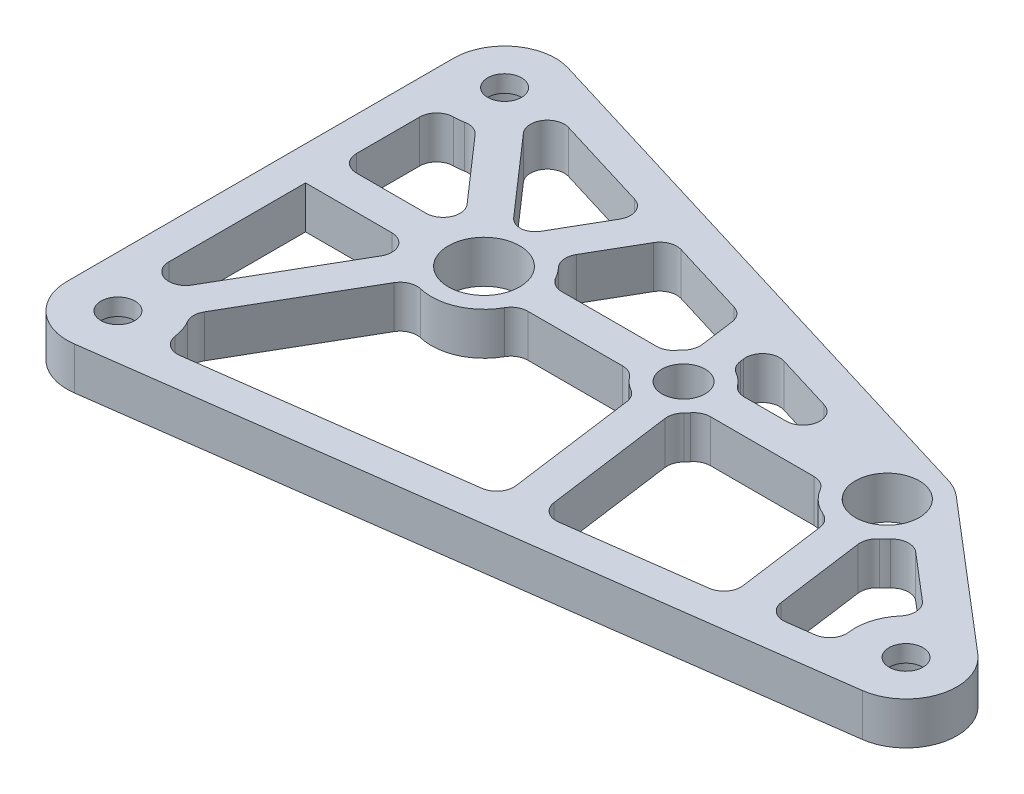
from build123d import *

# Parameters (mm, degrees)
SKETCH1_W           = 68.667901423
SKETCH1_H           = 36.53900895
SKETCH1_R           = 1.6129
SKETCH1_R_2         = 2.667
BOSS_EXTRUDE1_DEPTH = 3.175
SKETCH2_R           = 1.27
CUT_EXTRUDE1_DEPTH  = 38.354
CUT_EXTRUDE2_START  = -1.905
SKETCH3_R           = 2.54
SKETCH3_R_2         = 1.27
CUT_EXTRUDE2_DEPTH  = 1.905
SKETCH4_R           = 1.016
CUT_EXTRUDE3_DEPTH  = 25.4
SKETCH5_R           = 2.3876
CUT_EXTRUDE4_DEPTH  = 19.05
CUT_EXTRUDE5_DEPTH  = 19.05
FILLET1_R           = 1.27
FILLET2_R           = 1.27
FILLET3_R           = 1.27
FILLET4_START       = -1
FILLET4_DEPTH       = 5
FILLET4_2_DEPTH     = 3.175
FILLET5_R           = 1.27
FILLET6_R           = 1.27
FILLET7_START       = -1
FILLET7_DEPTH       = 5
FILLET7_2_DEPTH     = 3.175
FILLET8_R           = 1.27


with BuildPart() as part:
    # Sketch1 → Boss-Extrude1 (new body)
    with BuildSketch(Plane(origin=(0, 0, 0), x_dir=(1, 0, 0), z_dir=(0, 1, 0))):
        with Locations((4.791902673, -2.112780122)):
            Rectangle(SKETCH1_W, SKETCH1_H)
        with Locations(Location((0, 0, 0), (0, 0, 270))):
            Circle(SKETCH1_R, mode=Mode.SUBTRACT)
        with Locations(Location((-14.9225, 0, 0), (0, 0, 270))):
            Circle(SKETCH1_R_2, mode=Mode.SUBTRACT)
    extrude(amount=BOSS_EXTRUDE1_DEPTH)

    # Sketch2 → Cut-Extrude1 (cut)
    with BuildSketch(Plane(origin=(0, 3.175, 0), x_dir=(1, 0, 0), z_dir=(0, 1, 0))):
        with Locations(Location((-25.732048039, 12.346724353, 0), (0, 0, 270))):
            Circle(SKETCH2_R)
        with Locations(Location((-25.732048039, -16.572284597, 0), (0, 0, 270))):
            Circle(SKETCH2_R)
        with Locations(Location((26.190646926, -9.550213888, 0), (0, 0, 270))):
            Circle(SKETCH2_R)
    extrude(amount=-CUT_EXTRUDE1_DEPTH, mode=Mode.SUBTRACT)

    # Sketch3 → Cut-Extrude2 (cut)
    # profile 1 of 3: a face of its own
    with BuildSketch(Plane.XZ.offset(CUT_EXTRUDE2_START)):
        with Locations(Location((26.190646926, 9.550213888, 0), (0, 0, 270))):
            Circle(SKETCH3_R)
        with Locations(Location((26.190646926, 9.550213888, 0), (0, 0, 90))):
            Circle(SKETCH3_R_2, mode=Mode.SUBTRACT)
    # profile 2 of 3: a face of its own
    with BuildSketch(Plane.XZ.offset(CUT_EXTRUDE2_START)):
        with Locations(Location((-25.732048039, -12.346724353, 0), (0, 0, 270))):
            Circle(SKETCH3_R)
        with Locations(Location((-25.732048039, -12.346724353, 0), (0, 0, 90))):
            Circle(SKETCH3_R_2, mode=Mode.SUBTRACT)
    # profile 3 of 3: a face of its own
    with BuildSketch(Plane.XZ.offset(CUT_EXTRUDE2_START)):
        with Locations(Location((-25.732048039, 16.572284597, 0), (0, 0, 270))):
            Circle(SKETCH3_R)
        with Locations(Location((-25.732048039, 16.572284597, 0), (0, 0, 90))):
            Circle(SKETCH3_R_2, mode=Mode.SUBTRACT)
    extrude(amount=CUT_EXTRUDE2_DEPTH, mode=Mode.SUBTRACT)

    # Sketch4 → Cut-Extrude3 (cut)
    with BuildSketch(Plane(origin=(0, 3.175, 0), x_dir=(1, 0, 0), z_dir=(0, 1, 0))):
        with Locations(Location((15.24, 0, 0), (0, 0, 270))):
            Circle(SKETCH4_R)
    extrude(amount=-CUT_EXTRUDE3_DEPTH, mode=Mode.SUBTRACT)

    # Sketch5 → Cut-Extrude4 (cut)
    with BuildSketch(Plane(origin=(0, 3.175, 0), x_dir=(1, 0, 0), z_dir=(0, 1, 0))):
        with Locations(Location((15.24, 0, 0), (0, 0, 270))):
            Circle(SKETCH5_R)
    extrude(amount=-CUT_EXTRUDE4_DEPTH, mode=Mode.SUBTRACT)

    # Sketch7 → Cut-Extrude5 (cut)
    with BuildSketch(Plane.XZ):
        with BuildLine():
            ThreePointArc((24.283482048, 6.25190794), (22.535559112, 8.474838107), (22.801156981, 11.290173058))
            Line((22.801156981, 11.290173058), (18.133820494, 11.921387729))
            Line((18.133820494, 11.921387729), (16.958238715, 3.228884247))
            ThreePointArc((16.958238715, 3.228884247), (17.943553782, 2.463500498), (18.614285435, 1.411465749))
            Line((18.614285435, 1.411465749), (24.283482048, 6.25190794))
        make_face()
        with BuildLine():
            Line((3.167554903, 13.945438586), (1.605400683, 2.394535666))
            ThreePointArc((1.605400683, 2.394535666), (2.170826382, 1.897004278), (2.588090495, 1.27))
            Line((2.588090495, 1.27), (11.809965341, 1.27))
            ThreePointArc((11.809965341, 1.27), (12.833228053, 2.754176203), (14.441153278, 3.569297084))
            Line((14.441153278, 3.569297084), (15.616735056, 12.261800567))
            Line((15.616735056, 12.261800567), (3.167554903, 13.945438586))
        make_face()
        with BuildLine():
            Line((0.911684755, -2.734948504), (0.515711761, -5.662857637))
            Line((0.515711761, -5.662857637), (12.235310683, -2.085636563))
            ThreePointArc((12.235310683, -2.085636563), (11.996894404, -1.691243285), (11.809965341, -1.27))
            Line((11.809965341, -1.27), (2.588090495, -1.27))
            ThreePointArc((2.588090495, -1.27), (1.897004278, -2.170826382), (0.911684755, -2.734948504))
        make_face()
        with BuildLine():
            Line((-22.833883449, 14.099079792), (-16.706992842, 3.509352404))
            ThreePointArc((-16.706992842, 3.509352404), (-13.440421223, 3.647384199), (-11.195964209, 1.27))
            Line((-11.195964209, 1.27), (-2.588090495, 1.27))
            ThreePointArc((-2.588090495, 1.27), (-1.897004278, 2.170826382), (-0.911684755, 2.734948504))
            Line((-0.911684755, 2.734948504), (0.650469465, 14.285851424))
            Line((0.650469465, 14.285851424), (-22.002145257, 17.349410864))
            ThreePointArc((-22.002145257, 17.349410864), (-21.942125243, 16.962906152), (-21.922048039, 16.572284597))
            ThreePointArc((-21.922048039, 16.572284597), (-22.15726783, 15.254314015), (-22.833883449, 14.099079792))
        make_face()
        with BuildLine():
            ThreePointArc((-11.195964209, -1.27), (-11.813082161, -2.41484776), (-12.76953075, -3.296163286))
            Line((-12.76953075, -3.296163286), (-9.611736397, -8.754100026))
            Line((-9.611736397, -8.754100026), (-2.1577732, -6.478896377))
            Line((-2.1577732, -6.478896377), (-1.605400683, -2.394535666))
            ThreePointArc((-1.605400683, -2.394535666), (-2.170826382, -1.897004278), (-2.588090495, -1.27))
            Line((-2.588090495, -1.27), (-11.195964209, -1.27))
        make_face()
        with BuildLine():
            ThreePointArc((-15.346499164, -3.914101903), (-15.893789027, -3.815306885), (-16.421697772, -3.640381167))
            Line((-16.421697772, -3.640381167), (-22.410331951, -10.480631582))
            ThreePointArc((-22.410331951, -10.480631582), (-22.046139854, -11.382265514), (-21.922048039, -12.346724353))
            ThreePointArc((-21.922048039, -12.346724353), (-21.922952719, -12.429747482), (-21.925666328, -12.512731183))
            Line((-21.925666328, -12.512731183), (-12.105779444, -9.515366978))
            Line((-12.105779444, -9.515366978), (-15.346499164, -3.914101903))
        make_face()
        with BuildLine():
            Line((-24.32140384, -8.807489557), (-18.332769661, -1.967239142))
            ThreePointArc((-18.332769661, -1.967239142), (-18.507891697, -1.62632573), (-18.649035791, -1.27))
            Line((-18.649035791, -1.27), (-27.002048039, -1.27))
            Line((-27.002048039, -1.27), (-27.002048039, -8.754621904))
            ThreePointArc((-27.002048039, -8.754621904), (-25.656921846, -8.5374651), (-24.32140384, -8.807489557))
        make_face()
        with BuildLine():
            Line((-27.002048039, 1.27), (-18.649035791, 1.27))
            ThreePointArc((-18.649035791, 1.27), (-18.591418386, 1.42793798), (-18.527110715, 1.583272117))
            Line((-18.527110715, 1.583272117), (-25.032426592, 12.82707034))
            ThreePointArc((-25.032426592, 12.82707034), (-26.027333883, 12.773744578), (-27.002048039, 12.980182148))
            Line((-27.002048039, 12.980182148), (-27.002048039, 1.27))
        make_face()
        with BuildLine():
            Line((16.307789916, -3.498265635), (-24.619766876, -15.990751056))
            ThreePointArc((-24.619766876, -15.990751056), (-25.16974996, -16.11500259), (-25.732048039, -16.156724353))
            Line((-25.732048039, -16.156724353), (39.125853384, -16.156724353))
            Line((39.125853384, -16.156724353), (39.125853384, 20.382284597))
            Line((39.125853384, 20.382284597), (-25.732048066, 20.382284597))
            ThreePointArc((-25.732048066, 20.382284597), (-25.476160651, 20.373681924), (-25.221428783, 20.347912753))
            Line((-25.221428783, 20.347912753), (26.701266182, 13.325842044))
            ThreePointArc((26.701266182, 13.325842044), (29.059580471, 12.057267999), (30.000646926, 9.550213888))
            ThreePointArc((30.000646926, 9.550213888), (29.650549633, 7.954853972), (28.66459797, 6.652686281))
            Line((28.66459797, 6.652686281), (17.614993002, -2.781626503))
            ThreePointArc((17.614993002, -2.781626503), (16.998289358, -3.207250582), (16.307789916, -3.498265635))
        make_face()
        with BuildLine():
            ThreePointArc((-25.732048039, -16.156724353), (-28.426124875, -15.040801189), (-29.542048039, -12.346724353))
            Line((-29.542048039, -12.346724353), (-29.542048039, -16.156724353))
            Line((-29.542048039, -16.156724353), (-25.732048039, -16.156724353))
        make_face()
        with BuildLine():
            Line((-29.542048039, 20.382284597), (-29.542048039, 16.572284597))
            ThreePointArc((-29.542048039, 16.572284597), (-28.426124885, 19.266361423), (-25.732048066, 20.382284597))
            Line((-25.732048066, 20.382284597), (-29.542048039, 20.382284597))
        make_face()
    extrude(amount=-CUT_EXTRUDE5_DEPTH, mode=Mode.SUBTRACT)

    # Fillet1
    fillet1_edges = [part.edges().sort_by_distance(p)[0] for p in [
        (-0.911684755, 1.5875, 2.734948504),
        (-2.588090495, 1.5875, 1.27),
        (-11.195964209, 1.5875, 1.27),
        (-16.706992842, 1.5875, 3.509352404),
        (-22.833883449, 1.5875, 14.099079792),
        (-22.002145257, 1.5875, 17.349410864),
        (0.650469465, 1.5875, 14.285851424),
        (2.588090495, 1.5875, 1.27),
        (1.605400683, 1.5875, 2.394535666),
        (3.167554903, 1.5875, 13.945438586),
        (15.616735056, 1.5875, 12.261800567),
        (14.441153278, 1.5875, 3.569297084),
        (11.809965341, 1.5875, 1.27),
    ]]
    fillet(fillet1_edges, radius=FILLET1_R)

    # Fillet2
    # the kernel refuses this fillet: 1.27 mm, written as the material it adds along each edge
    with BuildSketch(Plane(origin=(-2.588090495, 0, -1.27), x_dir=(-1, 0, 0), z_dir=(0, 1, 0)), Plane(origin=(0.911684755, 0, -2.734948504), x_dir=(-0.13402080215822088, 0, -0.9909785187323018), z_dir=(0, 1, 0))) as fillet2_piece_1:
        with BuildLine():
            CenterArc((0.697480751, -1.27), FILLET2_R, 90, 52.293210506)
            ThreePointArc((-0.307281098, -0.49324159), (-0.141180534, -0.254383172), (0, 0))
            Line((0, 0), (0.697480751, 0))
        make_face()
    extrude(amount=3.175)
    with BuildSketch(Plane(origin=(-1.605400683, 0, -2.394535666), x_dir=(-0.7702439046779904, 0, 0.6377494236033482), z_dir=(0, 1, 0))) as fillet2_piece_2:
        with BuildLine():
            CenterArc((0.709128909, -1.263532979), FILLET2_R, 95.784587272, 52.293210506)
            Line((-0.368804995, -0.591998542), (0, 0))
            ThreePointArc((0, 0), (0.29056365, -0.014680138), (0.581127301, 0))
        make_face()
    extrude(amount=3.175)
    with BuildSketch(Plane(origin=(-2.1577732, 0, -6.478896377), x_dir=(0.13402080215820786, 0, 0.9909785187323036), z_dir=(0, 1, 0))) as fillet2_piece_3:
        with BuildLine():
            CenterArc((FILLET2_R * 0.641052696035, -FILLET2_R), FILLET2_R, 90, 65.324022769)
            Line((-FILLET2_R * 0.267630603442, -FILLET2_R * 0.582513878972), (0, 0))
            Line((0, 0), (FILLET2_R * 0.641052696035, 0))
        make_face()
    extrude(amount=3.175)
    with BuildSketch(Plane(origin=(-9.611736397, 0, -8.754100026), x_dir=(0.9564374549427981, 0, 0.29193731310427423), z_dir=(0, 1, 0))) as fillet2_piece_4:
        with BuildLine():
            CenterArc((FILLET2_R * 0.79431977754, -FILLET2_R), FILLET2_R, 90, 76.921621698)
            Line((-FILLET2_R * 0.179741651748, -FILLET2_R * 0.773716257822), (0, 0))
            Line((0, 0), (FILLET2_R * 0.79431977754, 0))
        make_face()
    extrude(amount=3.175)
    with BuildSketch(Plane(origin=(-12.76953075, 0, -3.296163286), x_dir=(0.5007911229282502, 0, -0.8655681666952999), z_dir=(0, 1, 0))) as fillet2_piece_5:
        with BuildLine():
            CenterArc((1.060150486, -1.27), FILLET2_R, 90, 73.454268433)
            ThreePointArc((-0.157262292, -0.908328699), (-0.051953965, -0.458783068), (0, 0))
            Line((0, 0), (1.060150486, 0))
        make_face()
    extrude(amount=3.175)
    with BuildSketch(Plane(origin=(-11.195964209, 0, -1.27), x_dir=(1, 0, 0), z_dir=(0, 1, 0))) as fillet2_piece_6:
        with BuildLine():
            CenterArc((0.818928872, 1.27), FILLET2_R, 209.19640441, 60.80359559)
            ThreePointArc((-0.289721046, 0.650487805), (-0.130123506, 0.331807629), (0, 0))
            Line((0, 0), (0.818928872, 0))
        make_face()
    extrude(amount=3.175)
    with BuildSketch(Plane(origin=(2.588090495, 0, -1.27), x_dir=(1, 0, 0), z_dir=(0, 1, 0))) as fillet2_piece_7:
        with BuildLine():
            CenterArc((0.697480751, 1.27), FILLET2_R, 217.706789494, 52.293210506)
            ThreePointArc((-0.307281098, 0.49324159), (-0.141180534, 0.254383172), (0, 0))
            Line((0, 0), (0.697480751, 0))
        make_face()
    extrude(amount=3.175)
    with BuildSketch(Plane(origin=(0.515711761, 0, -5.662857637), x_dir=(0.9564374549427986, 0, 0.2919373131042724), z_dir=(0, 1, 0))) as fillet2_piece_8:
        with BuildLine():
            CenterArc((FILLET2_R * 1.55993416171, -FILLET2_R), FILLET2_R, 90, 114.675977231)
            Line((FILLET2_R * 0.651250862231, -FILLET2_R * 1.41748612103), (0, 0))
            Line((0, 0), (FILLET2_R * 1.55993416171, 0))
        make_face()
    extrude(amount=3.175)
    with BuildSketch(Plane(origin=(-16.421697772, 0, -3.640381167), x_dir=(-0.658717332720766, 0, -0.7523905073651843), z_dir=(0, 1, 0))) as fillet2_piece_9:
        with BuildLine():
            CenterArc((0.818928872, -1.27), FILLET2_R, 90, 60.80359559)
            ThreePointArc((-0.289721046, -0.650487805), (-0.130123506, -0.331807629), (0, 0))
            Line((0, 0), (0.818928872, 0))
        make_face()
    extrude(amount=3.175)
    with BuildSketch(Plane(origin=(-15.346499164, 0, -3.914101903), x_dir=(-0.9850703715861643, 0, 0.17215215079427879), z_dir=(0, 1, 0))) as fillet2_piece_10:
        with BuildLine():
            CenterArc((0.594933787, -1.267309092), FILLET2_R, 93.730456084, 46.304216541)
            Line((-0.378436487, -0.451557714), (0, 0))
            ThreePointArc((0, 0), (0.256152047, -0.008341816), (0.512304094, 0))
        make_face()
    extrude(amount=3.175)
    with BuildSketch(Plane(origin=(-12.105779444, 0, -9.515366978), x_dir=(-0.5007911229282842, 0, 0.8655681666952801), z_dir=(0, 1, 0))) as fillet2_piece_11:
        with BuildLine():
            CenterArc((FILLET2_R * 1.25893881567, -FILLET2_R), FILLET2_R, 90, 103.078378302)
            Line((FILLET2_R * 0.284877386383, -FILLET2_R * 1.22628374218), (0, 0))
            Line((0, 0), (FILLET2_R * 1.25893881567, 0))
        make_face()
    extrude(amount=3.175)
    with BuildSketch(Plane(origin=(18.614285435, 0, 1.411465749), x_dir=(0.7605059335910243, 0, 0.6493309826065937), z_dir=(0, 1, 0))) as fillet2_piece_12:
        with BuildLine():
            CenterArc((1.442570198, -1.27), FILLET2_R, 90, 88.227682959)
            ThreePointArc((0.173177741, -1.230721649), (0.139246283, -0.607951276), (0, 0))
            Line((0, 0), (1.442570198, 0))
        make_face()
    extrude(amount=3.175)
    with BuildSketch(Plane(origin=(16.958238715, 0, 3.228884247), x_dir=(0.8350880749970998, 0, -0.5501162667996996), z_dir=(0, 1, 0))) as fillet2_piece_13:
        with BuildLine():
            CenterArc((0.801297273, -1.26445618), FILLET2_R, 95.355480643, 58.971531079)
            Line((-0.343330063, -0.714248708), (0, 0))
            ThreePointArc((0, 0), (0.341381087, -0.015966203), (0.682762173, 0))
        make_face()
    extrude(amount=3.175)
    with BuildSketch(Plane(origin=(18.133820494, 0, 11.921387729), x_dir=(-0.1340208021582057, 0, -0.9909785187323039), z_dir=(0, 1, 0))) as fillet2_piece_14:
        with BuildLine():
            CenterArc((FILLET2_R, -FILLET2_R), FILLET2_R, 90, 90)
            Line((0, -FILLET2_R), (0, 0))
            Line((0, 0), (FILLET2_R, 0))
        make_face()
    extrude(amount=3.175)
    with BuildSketch(Plane(origin=(22.801156981, 0, 11.290173058), x_dir=(-0.9909785187323036, 0, 0.13402080215820739), z_dir=(0, 1, 0))) as fillet2_piece_15:
        with BuildLine():
            CenterArc((1.487897552, -1.27), FILLET2_R, 90, 90)
            ThreePointArc((0.217897552, -1.27), (0.163028064, -0.625721461), (0, 0))
            Line((0, 0), (1.487897552, 0))
        make_face()
    extrude(amount=3.175)
    with BuildSketch(Plane(origin=(24.283482048, 0, 6.25190794), x_dir=(-0.7605059335910124, 0, -0.6493309826066076), z_dir=(0, 1, 0))) as fillet2_piece_16:
        with BuildLine():
            CenterArc((1.487897552, 1.27), FILLET2_R, 180, 90)
            ThreePointArc((0.217897552, 1.27), (0.163028064, 0.625721461), (0, 0))
            Line((0, 0), (1.487897552, 0))
        make_face()
    extrude(amount=3.175)

    # Fillet3
    # the kernel refuses this fillet: 1.27 mm, written as the material it adds along each edge
    with BuildSketch(Plane(origin=(11.809965341, 0, -1.27), x_dir=(-1, 0, 0), z_dir=(0, 1, 0))) as fillet3_piece_1_section:
        with BuildLine():
            CenterArc((5.413477355, -1.27), FILLET3_R, 90, 163.026024214)
            Line((5.042716967, -2.484675568), (5.005640928, -2.606143125))
            ThreePointArc((5.005640928, -2.606143125), (-0.462421381, -0.937104119), (-0.119098426, 0.044097222))
            Line((-0.119098426, 0.044097222), (0, 0.127))
            Line((0, 0.127), (5.413477355, 0.127))
            Line((5.413477355, 0.127), (5.413477355, 0))
        make_face()
    fillet3_piece_1 = extrude(amount=3.175, mode=Mode.PRIVATE)
    fillet3_piece_1 = split(fillet3_piece_1, bisect_by=Plane(origin=(12.815479054, 0, -4.564237952), z_dir=(-0.2919373131042727, 0, 0.9564374549427986)), keep=Keep.TOP, mode=Mode.PRIVATE)
    add(fillet3_piece_1)
    with BuildSketch(Plane(origin=(12.235310683, 0, -2.085636563), x_dir=(-0.9903835918786382, 0, 0.13834862101794548), z_dir=(0, 1, 0))) as fillet3_piece_2:
        with BuildLine():
            CenterArc((5.71981364, -1.257787162), FILLET3_R, 82.047700683, 163.026024214)
            Line((5.184569945, -2.409487725), (5.131045576, -2.524657781))
            Line((5.131045576, -2.524657781), (-0.053524369, -0.115170056))
            Line((-0.053524369, -0.115170056), (-0.093307294, 0.086155377))
            ThreePointArc((-0.093307294, 0.086155377), (0.551667516, 0.874725843), (5.913086663, 0.125778716))
            Line((5.913086663, 0.125778716), (5.895516388, 0))
        make_face()
    extrude(amount=3.175)

    # Fillet4: read off the stored shape, not the designer's step
    # Fillet4 outline → Fillet4 (cut)
    with BuildSketch(Plane(origin=(0, 0, 0), x_dir=(1, 0, 0), z_dir=(0, 1, 0)).offset(FILLET4_START)):
        with BuildLine():
            ThreePointArc((-22.347630138, 10.596919944), (-22.088021336, 11.23444319), (-21.947360372, 11.908273371))
            ThreePointArc((-21.947360372, 11.908273371), (-22.339661761, 11.311252425), (-22.347630138, 10.596919944))
        make_face()
    extrude(amount=FILLET4_DEPTH, mode=Mode.SUBTRACT)

    # Fillet4 2 outline → Fillet4 2 (add)
    with BuildSketch(Plane(origin=(0, 0, 0), x_dir=(1, 0, 0), z_dir=(0, 1, 0))):
        with BuildLine():
            ThreePointArc((-22.080522137, 10.103921025), (-22.241623507, 10.335495253), (-22.347630138, 10.596919944))
            ThreePointArc((-22.347630138, 10.596919944), (-22.378476955, 10.538503962), (-22.410331951, 10.480631582))
            Line((-22.410331951, 10.480631582), (-22.080522137, 10.103921025))
        make_face()
        with BuildLine():
            ThreePointArc((-21.947360372, 11.908273371), (-21.382334099, 12.184144744), (-20.754225805, 12.155167605))
            Line((-20.754225805, 12.155167605), (-21.925666328, 12.512731183))
            ThreePointArc((-21.925666328, 12.512731183), (-21.924499499, 12.210071099), (-21.947360372, 11.908273371))
        make_face()
    extrude(amount=FILLET4_2_DEPTH)

    # Fillet5
    # the kernel refuses this fillet: 1.27 mm, written as the material it adds along each edge
    with BuildSketch(Plane(origin=(-18.527110715, 0, 1.583272117), x_dir=(-0.988195887898241, 0, -0.15319558460023225), z_dir=(0, 1, 0))) as fillet5_piece_1:
        with BuildLine():
            CenterArc((1.850357705, 1.255008778), FILLET5_R, 158.759806957, 120.052354089)
            Line((0.666628943, 1.715102482), (0.548256066, 1.761111852))
            Line((0.548256066, 1.761111852), (-0.118372876, 0.04600937))
            Line((-0.118372876, 0.04600937), (-0.107081006, -0.068283659))
            ThreePointArc((-0.107081006, -0.068283659), (0.187933603, -0.416396712), (2.064371937, -0.125500878))
            Line((2.064371937, -0.125500878), (2.044916098, 0))
        make_face()
    extrude(amount=3.175)
    with BuildSketch(Plane(origin=(-18.649035791, 0, 1.27), x_dir=(-0.38684547034051203, 0, 0.9221445559547743), z_dir=(0, 1, 0))) as fillet5_piece_2:
        with BuildLine():
            CenterArc((1.905686114, -1.259722843), FILLET5_R, 82.70600311, 120.052354089)
            Line((0.734562528, -1.75101659), (0.61745017, -1.800145965))
            Line((0.61745017, -1.800145965), (-0.117112359, -0.049129375))
            Line((-0.117112359, -0.049129375), (-0.084281196, 0.095003579))
            ThreePointArc((-0.084281196, 0.095003579), (0.257840021, 0.359592729), (2.083050189, 0.125972284))
            Line((2.083050189, 0.125972284), (2.066926182, 0))
        make_face()
    extrude(amount=3.175)

    # Fillet6
    # the kernel refuses this fillet: 1.27 mm, written as the material it adds along each edge
    with BuildSketch(Plane(origin=(-18.649035791, 0, -1.27), x_dir=(-1, 0, 0), z_dir=(0, 1, 0))) as fillet6_piece_1:
        with BuildLine():
            CenterArc((1.873138825, -1.27), FILLET6_R, 90, 131.20212251)
            Line((0.91760288, -2.106571013), (0.822049286, -2.190228114))
            ThreePointArc((0.822049286, -2.190228114), (-0.411819724, -0.780896243), (-0.120210832, 0.040967742))
            Line((-0.120210832, 0.040967742), (0, 0.127))
            Line((0, 0.127), (1.873138825, 0.127))
            Line((1.873138825, 0.127), (1.873138825, 0))
        make_face()
    extrude(amount=3.175)
    with BuildSketch(Plane(origin=(-18.332769661, 0, -1.967239142), x_dir=(-0.9528490081211133, 0, 0.303444834727188), z_dir=(0, 1, 0))) as fillet6_piece_2:
        with BuildLine():
            CenterArc((1.912371016, -1.21011824), FILLET6_R, 72.335374119, 131.20212251)
            Line((0.748036386, -1.717291653), (0.631602923, -1.768008994))
            Line((0.631602923, -1.768008994), (-0.116433463, -0.050717341))
            Line((-0.116433463, -0.050717341), (-0.085565274, 0.093848728))
            ThreePointArc((-0.085565274, 0.093848728), (0.551464978, 0.689406125), (2.33628345, 0.121011824))
            Line((2.33628345, 0.121011824), (2.297745956, 0))
        make_face()
    extrude(amount=3.175)

    # Fillet7: read off the stored shape, not the designer's step
    # Fillet7 outline → Fillet7 (cut)
    with BuildSketch(Plane(origin=(0, 0, 0), x_dir=(1, 0, 0), z_dir=(0, 1, 0)).offset(FILLET7_START)):
        with BuildLine():
            ThreePointArc((-25.855577937, -12.7642877), (-25.732048039, -12.770309708), (-25.608518142, -12.7642877))
            ThreePointArc((-25.608518142, -12.7642877), (-25.732048039, -12.762284596), (-25.855577937, -12.7642877))
        make_face()
    extrude(amount=FILLET7_DEPTH, mode=Mode.SUBTRACT)

    # Fillet7 2 outline → Fillet7 2 (add)
    with BuildSketch(Plane(origin=(0, 0, 0), x_dir=(1, 0, 0), z_dir=(0, 1, 0))):
        with BuildLine():
            Line((-25.032426592, -12.82707034), (-24.632776467, -12.136314434))
            ThreePointArc((-24.632776467, -12.136314434), (-25.044735545, -12.568252373), (-25.608518142, -12.7642877))
            ThreePointArc((-25.608518142, -12.7642877), (-25.319276978, -12.784710168), (-25.032426592, -12.82707034))
        make_face()
        with BuildLine():
            ThreePointArc((-27.002048039, -12.980182148), (-26.437125338, -12.828093629), (-25.855577937, -12.7642877))
            ThreePointArc((-25.855577937, -12.7642877), (-26.672734748, -12.353543858), (-27.002048039, -11.500309708))
            Line((-27.002048039, -11.500309708), (-27.002048039, -12.980182148))
        make_face()
    extrude(amount=FILLET7_2_DEPTH)

    # Fillet8
    fillet8_edges = [part.edges().sort_by_distance(p)[0] for p in [
        (-24.32140384, 1.5875, -8.807489557),
        (-27.002048039, 1.5875, -8.754621904),
        (-27.002048039, 1.5875, -1.27),
    ]]
    fillet(fillet8_edges, radius=FILLET8_R)


solid = part.part
